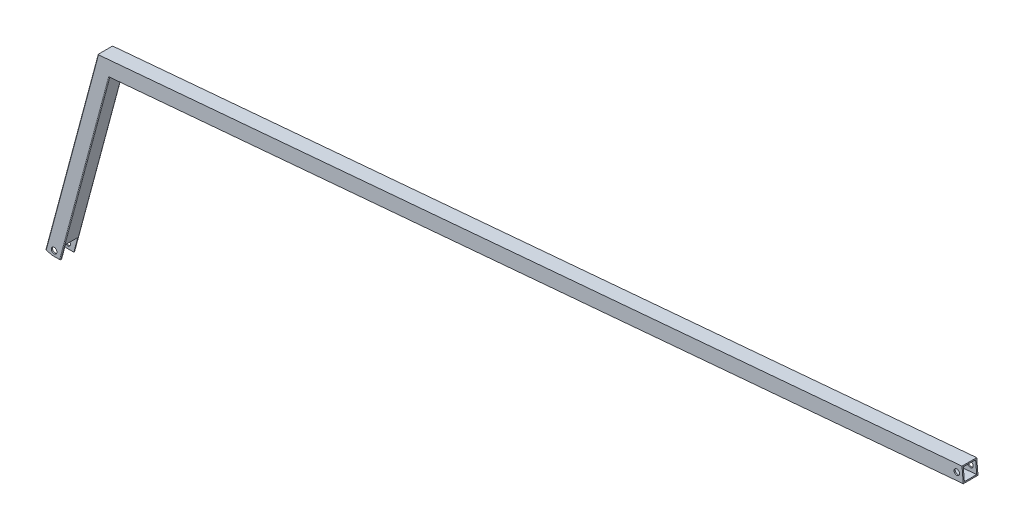
from build123d import *

# Parameters (mm, degrees)
SKETCH1_R           = 4.825999999999997
SKETCH1_R_2         = 4.82599999999999
BOSS_EXTRUDE1_DEPTH = 12.7
SHELL1_T            = -2.0574
FILLET1_R           = 1.27
CUT_EXTRUDE1_DEPTH  = 1688.3326563859755
SKETCH3_W           = 21.285199999999996
SKETCH3_H           = 25.39999999999992
CUT_EXTRUDE2_DEPTH  = 1687.1561100396323
FILLET2_R           = 1.27


with BuildPart() as part:
    # Sketch1 → Boss-Extrude1 (new, symmetric)
    with BuildSketch(Plane(origin=(0, 0, 0), x_dir=(-1, 0, 0), z_dir=(0, 0, -1))):
        Polygon((1525.3196968451302, -142.8140199015764), (32.895539800283125, -12.243824987918671), (30.681783934492614, -37.54717031944891), (1505.3883478362786, -166.56727668812414), (1591.0329934107308, -486.19744536820497), (1615.5675093984723, -479.62344162260115), align=None)
        with Locations((1600.835, -473.70999999999975)):
            Circle(SKETCH1_R, mode=Mode.SUBTRACT)
        with Locations((41.910000000000004, -25.781000000000002)):
            Circle(SKETCH1_R_2, mode=Mode.SUBTRACT)
    extrude(amount=BOSS_EXTRUDE1_DEPTH, both=True)

    # Shell1
    shell1_openings = [part.faces().sort_by_distance(p)[0] for p in [
        (-31.788661867, -24.895497654, 0),
        (-1596.009, -473.71, 0),
        (-1603.300251405, -482.910443495, 0),
        (-37.084, -25.781, 0),
    ]]
    offset(amount=SHELL1_T, openings=shell1_openings, kind=Kind.INTERSECTION)

    # Fillet1
    fillet1_edges = [part.edges().sort_by_distance(p)[0] for p in [
        (-1568.642735589439, -312.4469848136409, -10.642600000000002),
        (-1568.642735589439, -312.4469848136409, 10.642600000000002),
        (-1550.011538155867, -325.1541069766124, -10.6426),
        (-1550.011538155867, -325.1541069766124, 10.6426),
        (-1548.2106706235047, -326.38236102816455, 12.7),
        (-1570.4436031218013, -311.21873076208874, 12.7),
        (-1570.4436031218013, -311.21873076208874, -12.7),
        (-1548.2106706235047, -326.38236102816455, -12.7),
    ]]
    fillet(fillet1_edges, radius=FILLET1_R)

    # Sketch2 → Cut-Extrude1 (cut, through all)
    with BuildSketch(Plane(origin=(0, 0, -12.7), x_dir=(-1, 0, 0), z_dir=(0, 0, -1))):
        Polygon((1604.458842302323, -482.6000000000005), (1590.0690608295051, -482.6000000000005), (1591.0329934107308, -486.19744536820497), align=None)
    extrude(amount=-CUT_EXTRUDE1_DEPTH, mode=Mode.SUBTRACT)

    # Sketch3 → Cut-Extrude2 (cut, through all)
    with BuildSketch(Plane(origin=(0, 0, 0), x_dir=(0, 0, -1), z_dir=(1, 0, 0))):
        with Locations((0, -469.89999999999975)):
            Rectangle(SKETCH3_W, SKETCH3_H)
    extrude(amount=-CUT_EXTRUDE2_DEPTH, mode=Mode.SUBTRACT)

    # Fillet2
    fillet2_edges = [part.edges().sort_by_distance(p)[0] for p in [
        (-1607.8367773428215, -457.19999999999976, -10.642599999999998),
        (-1584.9855403231031, -457.19999999999976, -10.642599999999998),
        (-1607.8367773428215, -457.19999999999976, 10.642599999999998),
        (-1584.9855403231031, -457.19999999999976, 10.642599999999998),
    ]]
    fillet(fillet2_edges, radius=FILLET2_R)


solid = part.part
